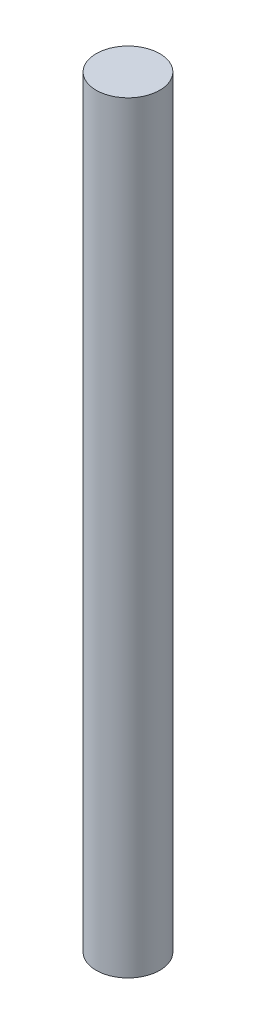
from build123d import *
from build123d.topology import SkipClean

# Parameters (mm, degrees)
BOSS_EXTRUDE1_DEPTH = 15
SKETCH2_R           = 2.5
BOSS_EXTRUDE2_DEPTH = 45


with BuildPart() as part:
    # Sketch1 → Boss-Extrude1 (new body)
    with BuildSketch(Plane(origin=(0, 0, 0), x_dir=(1, 0, 0), z_dir=(0, 1, 0))):
        with BuildLine():
            Line((-1.5, 2), (1.5, 2))
            ThreePointArc((1.5, 2), (0, -2.5), (-1.5, 2))
        make_face()
    extrude(amount=BOSS_EXTRUDE1_DEPTH)

    # Sketch2 → Boss-Extrude2 (add)
    with SkipClean():  # the faces are left unmerged after this step: merging them gives an invalid solid
        with BuildSketch(Plane(origin=(0, 15, 0), x_dir=(1, 0, 0), z_dir=(0, 1, 0))):
            Circle(SKETCH2_R)
        extrude(amount=BOSS_EXTRUDE2_DEPTH)
    add(part.part.scale(1), mode=Mode.REPLACE)  # the faces are merged on a copy


solid = part.part
